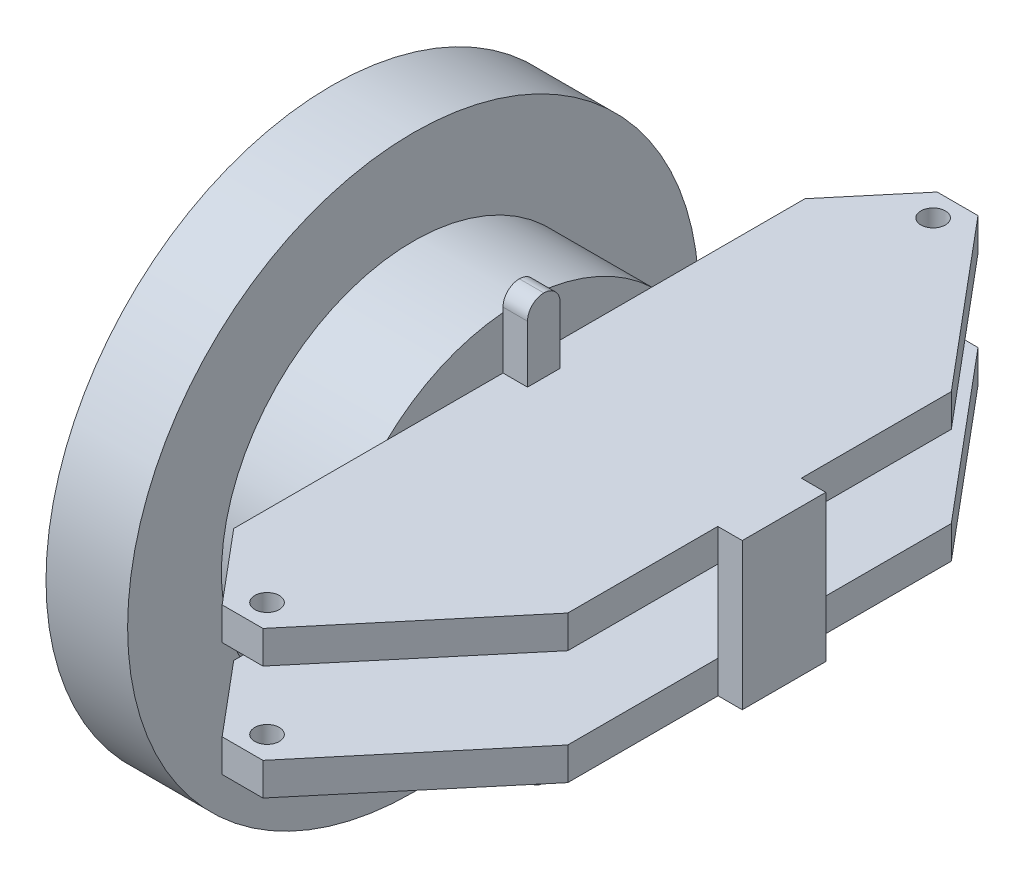
from build123d import *

# Parameters (mm, degrees)
SKETCH1_R            = 35
BOSS_EXTRUDE1_DEPTH  = 10
SKETCH2_R            = 23.5
BOSS_EXTRUDE2_DEPTH  = 13
BOSS_EXTRUDE4_DEPTH  = 4
SKETCH5_R            = 1.5
CUT_EXTRUDE1_DEPTH   = 86.86350209
SKETCH6_W            = 4
SKETCH6_H            = 9
BOSS_EXTRUDE5_DEPTH  = 3
FILLET1_R            = 2
FILLET1_OF_MIRROR2_R = 2
SKETCH8_R            = 10
CUT_EXTRUDE2_DEPTH   = 10
SKETCH11_W           = 10.23491337
SKETCH11_H           = 17.961461559
BOSS_EXTRUDE6_DEPTH  = 3


with BuildPart() as part:
    # Sketch1 → Boss-Extrude1 (new body)
    with BuildSketch(Plane(origin=(0, 0, 0), x_dir=(0, 0, -1), z_dir=(1, 0, 0))):
        Circle(SKETCH1_R)
    extrude(amount=BOSS_EXTRUDE1_DEPTH)

    # Sketch2 → Boss-Extrude2 (add)
    with BuildSketch(Plane(origin=(10, 0, 0), x_dir=(0, 0, -1), z_dir=(1, 0, 0))):
        with Locations(Location((0, 0, 0), (0, 0, 180))):
            Circle(SKETCH2_R)
    extrude(amount=BOSS_EXTRUDE2_DEPTH)

    # Sketch3 → Boss-Extrude4 (add)
    with BuildSketch(Plane(origin=(0, 13, 0), x_dir=(1, 0, 0), z_dir=(0, 1, 0))):
        Polygon((23, 35), (23, -35), (30.392057511, -43.809511096), (35.392057511, -43.809511096), (52.43346001, -23.500358445), (52.43346001, 23.500358445), (35.392057511, 43.809511096), (30.392057511, 43.809511096), align=None)
    boss_extrude4 = extrude(amount=BOSS_EXTRUDE4_DEPTH)

    # Sketch5 → Cut-Extrude1 (cut, symmetric)
    with BuildSketch(Plane(origin=(0, 17, 0), x_dir=(1, 0, 0), z_dir=(0, 1, 0))):
        with Locations(Location((32.892057511, -40.809511096, 0), (0, 0, 270))):
            Circle(SKETCH5_R)
        with Locations(Location((32.892057511, 40.809511096, 0), (0, 0, 270))):
            Circle(SKETCH5_R)
    cut_extrude1 = extrude(amount=CUT_EXTRUDE1_DEPTH, both=True, mode=Mode.SUBTRACT)

    # Sketch6 → Boss-Extrude5 (add)
    with BuildSketch(Plane(origin=(23, 0, 0), x_dir=(0, 0, -1), z_dir=(1, 0, 0))):
        with Locations((0, 21.5)):
            Rectangle(SKETCH6_W, SKETCH6_H)
    boss_extrude5 = extrude(amount=BOSS_EXTRUDE5_DEPTH)

    # Fillet1
    fillet1_edges = [part.edges().sort_by_distance(p)[0] for p in [
        (24.5, 26, -2),
        (24.5, 26, 2),
    ]]
    fillet(fillet1_edges, radius=FILLET1_R - 0.0001)  # a hair under: the kernel refuses the full size

    # Mirror2: Boss-Extrude5 across plane
    add(boss_extrude5.mirror(Plane.ZX))

    # Fillet1 of Mirror2
    fillet1_of_mirror2_edges = [part.edges().sort_by_distance(p)[0] for p in [
        (24.5, -26, -2),
        (24.5, -26, 2),
    ]]
    fillet(fillet1_of_mirror2_edges, radius=FILLET1_OF_MIRROR2_R - 0.0001)  # a hair under: the kernel refuses the full size

    # Sketch8 → Cut-Extrude2 (cut)
    with BuildSketch(Plane.ZY):
        Circle(SKETCH8_R)
    extrude(amount=-CUT_EXTRUDE2_DEPTH, mode=Mode.SUBTRACT)

    # Mirror3: Boss-Extrude4, Cut-Extrude1 across plane
    add(boss_extrude4.mirror(Plane(origin=(0, 8, 0), x_dir=(0, 0, 1), z_dir=(0, -1, 0))))
    add(cut_extrude1.mirror(Plane(origin=(0, 8, 0), x_dir=(0, 0, 1), z_dir=(0, -1, 0))), mode=Mode.SUBTRACT)

    # Sketch11 → Boss-Extrude6 (add)
    with BuildSketch(Plane(origin=(52.43346001, 0, 0), x_dir=(0, 0, -1), z_dir=(1, 0, 0))):
        with Locations((0, 8.019269221)):
            Rectangle(SKETCH11_W, SKETCH11_H)
    extrude(amount=BOSS_EXTRUDE6_DEPTH)


solid = part.part
